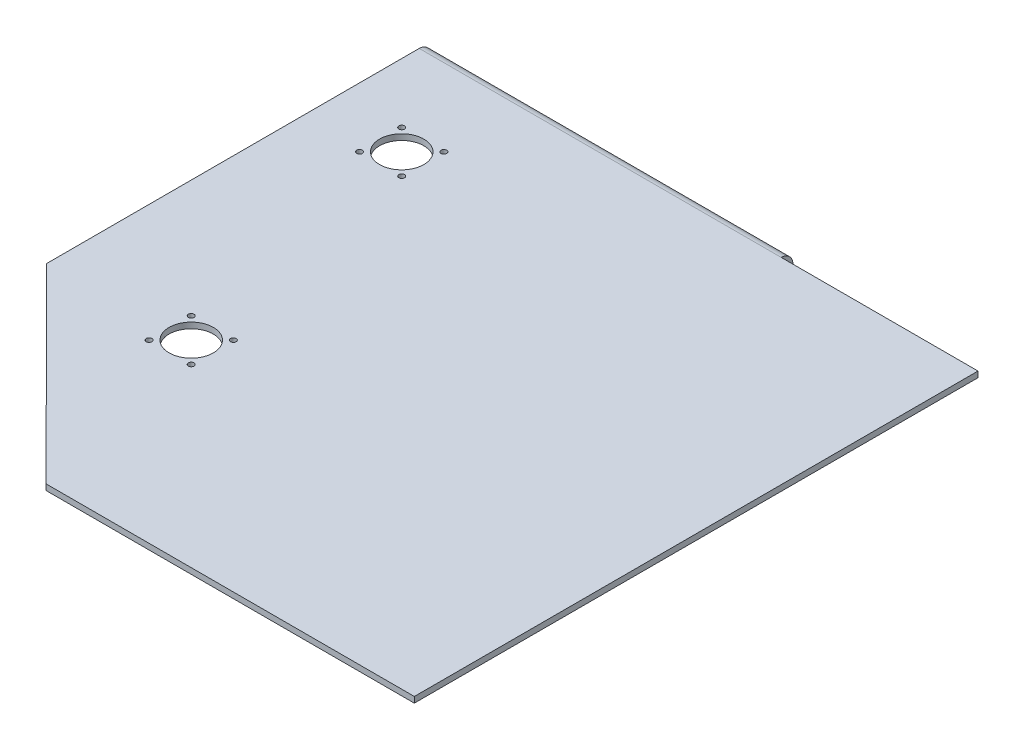
from build123d import *

# Parameters (mm, degrees)
BASE_FLANGE1_DEPTH = 3.175
EDGE_FLANGE1_DEPTH = 197.512880056
SKETCH9_R          = 12.065
CUT_EXTRUDE1_DEPTH = 3.175


# Sheet-metal steps are written as plain solids
with BuildPart() as part:
    # Sketch1 → Base-Flange1 (new body)
    with BuildSketch(Plane(origin=(0, 0, 0), x_dir=(1, 0, 0), z_dir=(0, 1, 0))):
        Polygon((154.686, -16.51), (355.6, -16.51), (355.6, 290.957), (50.8, 290.957), (50.8, 87.757), align=None)
    extrude(amount=-BASE_FLANGE1_DEPTH)

    # Edge-Flange1 section (across the edge) → Edge-Flange1 (add)
    with BuildSketch(Plane(origin=(50.8, -3.175, -294.132), x_dir=(0, 0, 1), z_dir=(1, 0, 0))):
        with BuildLine():
            Line((-3.175, 3.175), (-3.175, 34.925))
            Line((-3.175, 34.925), (0, 34.925))
            Line((0, 34.925), (0, 3.175))
            ThreePointArc((0, 3.175), (0.92993597, 0.92993597), (3.175, 0))
            Line((3.175, 0), (3.175, -3.175))
            ThreePointArc((3.175, -3.175), (-1.315128061, -1.315128061), (-3.175, 3.175))
        make_face()
    extrude(amount=EDGE_FLANGE1_DEPTH)

    # Sketch9 → Cut-Extrude1 (cut)
    with BuildSketch(Plane(origin=(0, 0, 0), x_dir=(1, 0, 0), z_dir=(0, 1, 0))):
        with BuildLine():
            ThreePointArc((84.925, 225.833155379), (83.375, 227.383155379), (81.825, 225.833155379))
            ThreePointArc((81.825, 225.833155379), (83.375, 224.283155379), (84.925, 225.833155379))
        make_face()
        with BuildLine():
            ThreePointArc((104.825, 225.833155379), (106.375, 224.283155379), (107.925, 225.833155379))
            ThreePointArc((107.925, 225.833155379), (106.375, 227.383155379), (104.825, 225.833155379))
        make_face()
        with BuildLine():
            ThreePointArc((104.825, 248.833155379), (106.375, 247.283155379), (107.925, 248.833155379))
            ThreePointArc((107.925, 248.833155379), (106.375, 250.383155379), (104.825, 248.833155379))
        make_face()
        with BuildLine():
            ThreePointArc((84.925, 248.833155379), (83.375, 250.383155379), (81.825, 248.833155379))
            ThreePointArc((81.825, 248.833155379), (83.375, 247.283155379), (84.925, 248.833155379))
        make_face()
        with Locations(Location((94.875, 237.333155379, 0), (0, 0, 270))):
            Circle(SKETCH9_R)
        with BuildLine():
            ThreePointArc((136.36996, 79.466155379), (137.91996, 77.916155379), (139.46996, 79.466155379))
            ThreePointArc((139.46996, 79.466155379), (137.91996, 81.016155379), (136.36996, 79.466155379))
        make_face()
        with BuildLine():
            ThreePointArc((136.36996, 102.466155379), (137.91996, 100.916155379), (139.46996, 102.466155379))
            ThreePointArc((139.46996, 102.466155379), (137.91996, 104.016155379), (136.36996, 102.466155379))
        make_face()
        with Locations(Location((126.41996, 90.966155379, 0), (0, 0, 270))):
            Circle(SKETCH9_R)
        with BuildLine():
            ThreePointArc((113.36996, 102.466155379), (114.91996, 100.916155379), (116.46996, 102.466155379))
            ThreePointArc((116.46996, 102.466155379), (114.91996, 104.016155379), (113.36996, 102.466155379))
        make_face()
        with BuildLine():
            ThreePointArc((113.36996, 79.466155379), (114.91996, 77.916155379), (116.46996, 79.466155379))
            ThreePointArc((116.46996, 79.466155379), (114.91996, 81.016155379), (113.36996, 79.466155379))
        make_face()
    extrude(amount=-CUT_EXTRUDE1_DEPTH, mode=Mode.SUBTRACT)


solid = part.part
